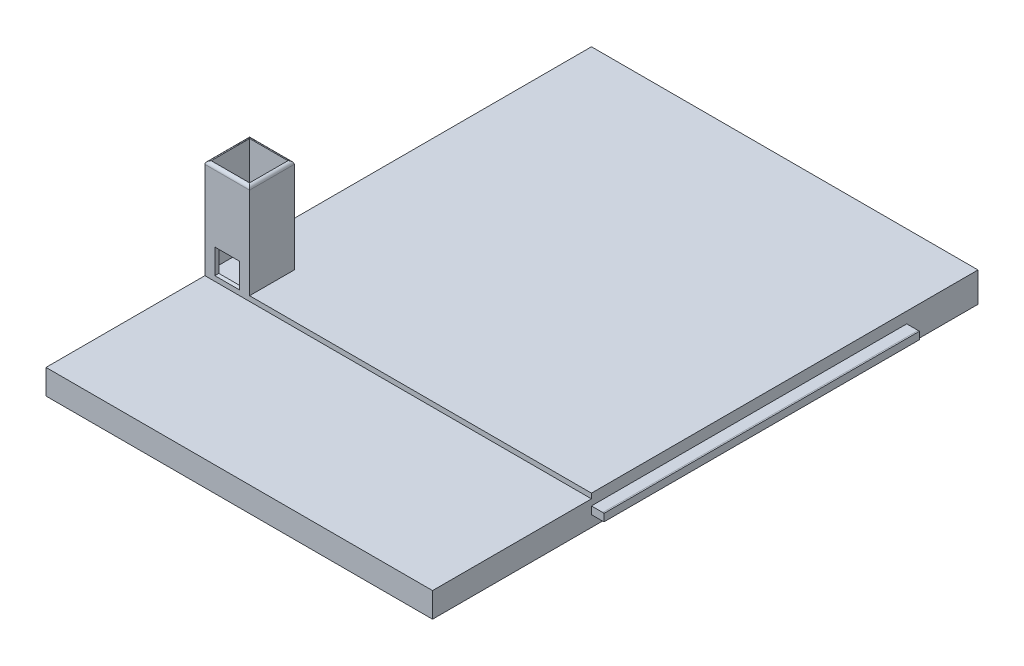
from build123d import *

# Parameters (mm, degrees)
SKETCH1_W           = 155.7
SKETCH1_H           = 155.7
BOSS_EXTRUDE2_DEPTH = 12
SKETCH2_W           = 18
SKETCH2_H           = 18
BOSS_EXTRUDE3_DEPTH = 38.1
SKETCH3_W           = 5.08
SKETCH3_H           = 3.048
BOSS_EXTRUDE4_DEPTH = 127
CHAMFER1_SIZE       = 0.508
CHAMFER1_SIZE2      = 0.03552282
CHAMFER2_SIZE       = 0.508
CHAMFER2_SIZE2      = 0.03552282
SKETCH4_W           = 5.334
SKETCH4_H           = 3.175
CUT_EXTRUDE3_DEPTH  = 149.86
FILLET1_R           = 1.27
SKETCH5_W           = 155.7
SKETCH5_H           = 64
BOSS_EXTRUDE5_DEPTH = 10
SKETCH6_W           = 10
SKETCH6_H           = 10
CUT_EXTRUDE5_DEPTH  = 5
CUT_EXTRUDE5_DRAFT  = -15
SKETCH8_W           = 15.46
SKETCH8_H           = 15.46
CUT_EXTRUDE6_DEPTH  = 38


with BuildPart() as part:
    # Sketch1 → Boss-Extrude2 (new body)
    with BuildSketch(Plane(origin=(0, 0, 0), x_dir=(1, 0, 0), z_dir=(0, 1, 0))):
        with Locations((55.528787879, -61.975)):
            Rectangle(SKETCH1_W, SKETCH1_H)
    extrude(amount=BOSS_EXTRUDE2_DEPTH)

    # Sketch2 → Boss-Extrude3 (add)
    with BuildSketch(Plane(origin=(0, 12, 0), x_dir=(1, 0, 0), z_dir=(0, 1, 0))):
        with Locations((-13.321212121, -130.825)):
            Rectangle(SKETCH2_W, SKETCH2_H)
    extrude(amount=BOSS_EXTRUDE3_DEPTH)

    # Sketch3 → Boss-Extrude4 (add)
    with BuildSketch(Plane.XY.offset(139.825)):
        with Locations((135.918787879, 6)):
            Rectangle(SKETCH3_W, SKETCH3_H)
    extrude(amount=-BOSS_EXTRUDE4_DEPTH)

    # Chamfer1
    chamfer1_edges = [part.edges().sort_by_distance(p)[0] for p in [
        (138.458787879, 7.524, 76.325),
    ]]
    chamfer1_side = [part.faces().sort_by_distance(p)[0] for p in [
        (135.918787879, 7.524, 76.325),
    ]]
    chamfer(chamfer1_edges, length=CHAMFER1_SIZE, length2=CHAMFER1_SIZE2, reference=chamfer1_side[0])

    # Chamfer2
    chamfer2_edges = [part.edges().sort_by_distance(p)[0] for p in [
        (138.458787879, 4.476, 76.325),
    ]]
    chamfer2_side = [part.faces().sort_by_distance(p)[0] for p in [
        (135.918787879, 4.476, 76.325),
    ]]
    chamfer(chamfer2_edges, length=CHAMFER2_SIZE, length2=CHAMFER2_SIZE2, reference=chamfer2_side[0])

    # Sketch4 → Cut-Extrude3 (cut)
    with BuildSketch(Plane.ZY.offset(22.321212121)):
        with Locations((-13.208, 6)):
            Rectangle(SKETCH4_W, SKETCH4_H)
    extrude(amount=-CUT_EXTRUDE3_DEPTH, mode=Mode.SUBTRACT)

    # Fillet1
    fillet1_edges = [part.edges().sort_by_distance(p)[0] for p in [
        (-22.321212121, 50.1, 130.825),
        (-13.321212121, 50.1, 139.825),
        (-4.321212121, 50.1, 130.825),
        (-13.321212121, 50.1, 121.825),
    ]]
    fillet(fillet1_edges, radius=FILLET1_R)

    # Sketch5 → Boss-Extrude5 (add)
    with BuildSketch(Plane(origin=(0, 0, 0), x_dir=(1, 0, 0), z_dir=(0, 1, 0))):
        with Locations((55.528787879, -171.825)):
            Rectangle(SKETCH5_W, SKETCH5_H)
    extrude(amount=BOSS_EXTRUDE5_DEPTH)


with BuildPart() as cut_extrude5_tool:
    # Sketch6 → Cut-Extrude5 (with draft: the straight prism first)
    with BuildSketch(Plane.XY.offset(139.825)):
        with Locations((-13.321212121, 17)):
            Rectangle(SKETCH6_W, SKETCH6_H)
    extrude(amount=-CUT_EXTRUDE5_DEPTH)
    # Cut-Extrude5: the draft: its side faces are tilted about the plane it starts from
    cut_extrude5_sides = [cut_extrude5_tool.faces().sort_by_distance(p)[0] for p in [
        (-8.321212121, 17, 137.325),
        (-13.321212121, 22, 137.325),
        (-18.321212121, 17, 137.325),
        (-13.321212121, 12, 137.325),
    ]]
    draft(cut_extrude5_sides, Plane.XY.offset(139.825), CUT_EXTRUDE5_DRAFT)


with BuildPart() as part_1:
    add(part.part)

    # Cut-Extrude5: cut by cut_extrude5_tool
    add(cut_extrude5_tool.part, mode=Mode.SUBTRACT)

    # Sketch8 → Cut-Extrude6 (cut)
    with BuildSketch(Plane(origin=(0, 50.1, 0), x_dir=(1, 0, 0), z_dir=(0, 1, 0))):
        with Locations((-13.321212121, -130.825)):
            Rectangle(SKETCH8_W, SKETCH8_H)
    extrude(amount=-CUT_EXTRUDE6_DEPTH, mode=Mode.SUBTRACT)


solid = part_1.part
